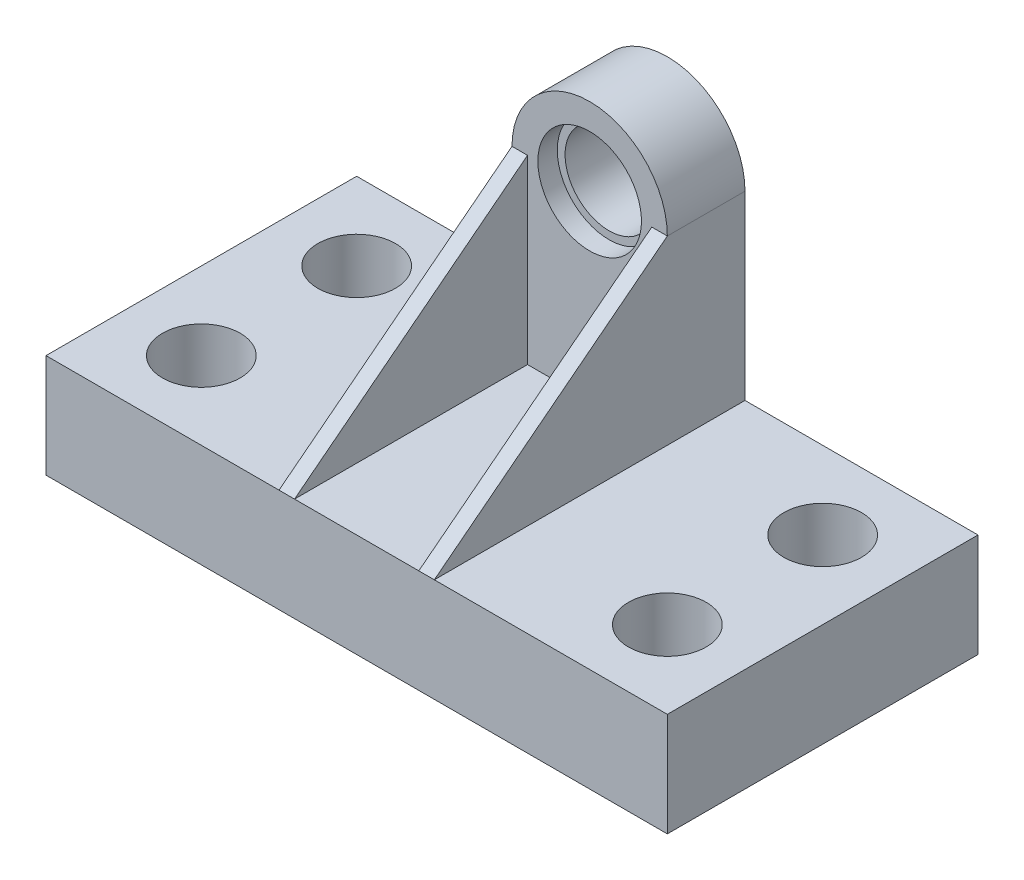
from build123d import *

# Parameters (mm, degrees)
EXTRUDE_1_DEPTH          = 228.6
CUT_EXTRUDE_1_DEPTH      = 624.723881217
CUT_EXTRUDE_1_DEPTH_BACK = 57.15
SKETCH_2_R               = 152.4
SKETCH_2_R_2             = 129.54
SKETCH_3_R               = 129.54
CUT_EXTRUDE_2_DEPTH      = 624.723881217
SKETCH_4_W               = 1828.8
SKETCH_4_H               = 914.4
EXTRUDE_2_DEPTH          = 304.8
RIB_START                = -45.72
RIB_11_DEPTH             = 45.72
SKETCH_6_R               = 114.3
CUT_EXTRUDE_3_DEPTH      = 1677.4


# Read off the part's stored shape, not the designer's step: 筋11
with BuildPart() as part:
    # 草图1 → 凸台-拉伸1 (new body)
    with BuildSketch(Plane.XY):
        with BuildLine():
            Line((-228.6, 0), (-228.6, -533.4))
            Line((-228.6, -533.4), (228.6, -533.4))
            Line((228.6, -533.4), (228.6, 0))
            ThreePointArc((228.6, 0), (0, 228.6), (-228.6, 0))
        make_face()
    extrude(amount=EXTRUDE_1_DEPTH)

    # 草图2 → 切除-拉伸1 (cut, two sides: drawn at the far end of the back side and taken through both)
    with BuildSketch(Plane.XY.offset(228.6).offset(-CUT_EXTRUDE_1_DEPTH_BACK)):
        with Locations(Location((0, 0, 0), (0, 0, 180))):
            Circle(SKETCH_2_R)
        with Locations(Location((0, 0, 0), (0, 0, 180))):
            Circle(SKETCH_2_R_2, mode=Mode.SUBTRACT)
    extrude(amount=CUT_EXTRUDE_1_DEPTH + CUT_EXTRUDE_1_DEPTH_BACK, mode=Mode.SUBTRACT)

    # 草图3 → 切除-拉伸2 (cut, through all)
    with BuildSketch(Plane.XY.offset(228.6)):
        Circle(SKETCH_3_R)
    extrude(amount=-CUT_EXTRUDE_2_DEPTH, mode=Mode.SUBTRACT)

    # 草图4 → 凸台-拉伸2 (add)
    with BuildSketch(Plane.XZ.offset(533.4)):
        with Locations((0, 457.2)):
            Rectangle(SKETCH_4_W, SKETCH_4_H)
    extrude(amount=EXTRUDE_2_DEPTH)

    # 筋11 outline → 筋11 (add)
    with BuildSketch(Plane(origin=(228.6, 0, 0), x_dir=(0, 0, -1), z_dir=(1, 0, 0)).offset(RIB_START)):
        Polygon((-228.6, -533.4), (-228.6, 0), (-914.4, -533.4), align=None)
    rib_11 = extrude(amount=RIB_11_DEPTH)

    # 镜向1: 筋11 across plane
    add(rib_11.mirror(Plane(origin=(0, 0, 0), x_dir=(0, 0, 1), z_dir=(1, 0, 0))))

    # 草图6 → 切除-拉伸3 (cut, through all)
    with BuildSketch(Plane.XZ.offset(838.2)):
        with Locations(Location((-685.8, 685.8, 0), (0, 0, 270))):
            Circle(SKETCH_6_R)
        with Locations(Location((-685.8, 228.6, 0), (0, 0, 90))):
            Circle(SKETCH_6_R)
        with Locations(Location((685.8, 228.6, 0), (0, 0, 270))):
            Circle(SKETCH_6_R)
        with Locations(Location((685.8, 685.8, 0), (0, 0, 90))):
            Circle(SKETCH_6_R)
    extrude(amount=-CUT_EXTRUDE_3_DEPTH, mode=Mode.SUBTRACT)


solid = part.part
